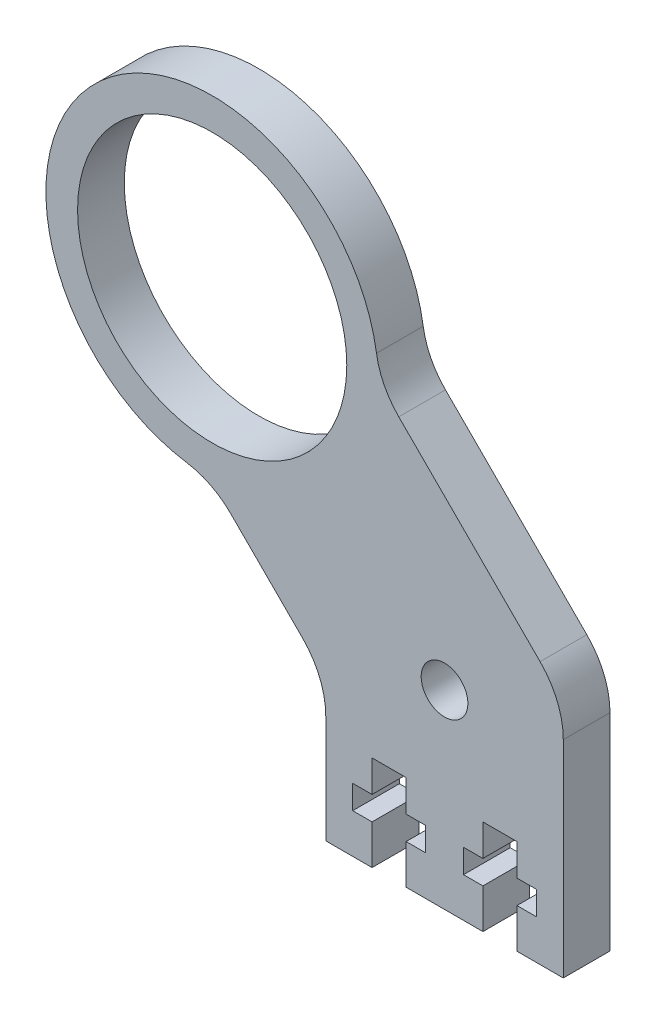
from build123d import *

# Parameters (mm, degrees)
SKETCH1_R           = 2.95
BOSS_EXTRUDE1_DEPTH = 5.9
SKETCH2_R           = 17
CUT_EXTRUDE1_DEPTH  = 72.442524026
CUT_EXTRUDE2_DEPTH  = 72.442524026
FILLET1_R           = 10


with BuildPart() as part:
    # Sketch1 → Boss-Extrude1 (new body)
    with BuildSketch(Plane.XY):
        with BuildLine():
            Line((-15, -6.213203436), (-15, -24))
            Line((-15, -24), (15, -24))
            Line((15, -24), (15, 6.213203436))
            Line((15, 6.213203436), (-8.346024856, 29.559228292))
            ThreePointArc((-8.346024856, 29.559228292), (-44.194173824, 44.194173824), (-29.559228292, 8.346024856))
            Line((-29.559228292, 8.346024856), (-15, -6.213203436))
        make_face()
        Circle(SKETCH1_R, mode=Mode.SUBTRACT)
    extrude(amount=BOSS_EXTRUDE1_DEPTH)

    # Sketch2 → Cut-Extrude1 (cut, through all)
    with BuildSketch(Plane.XY.offset(5.9)):
        with Locations((-29.344931419, 29.344931419)):
            Circle(SKETCH2_R)
    extrude(amount=-CUT_EXTRUDE1_DEPTH, mode=Mode.SUBTRACT)

    # Sketch3 → Cut-Extrude2 (cut, through all)
    with BuildSketch(Plane.XY.offset(5.9)):
        Polygon((-9.15, -24), (-4.85, -24), (-4.85, -19), (-2.4, -19), (-2.4, -16), (-4.85, -16), (-4.85, -12), (-9.15, -12), (-9.15, -16), (-11.6, -16), (-11.6, -19), (-9.15, -19), align=None)
        Polygon((4.85, -16), (4.85, -12), (9.15, -12), (9.15, -16), (11.6, -16), (11.6, -19), (9.15, -19), (9.15, -24), (4.85, -24), (4.85, -19), (2.4, -19), (2.4, -16), align=None)
    extrude(amount=-CUT_EXTRUDE2_DEPTH, mode=Mode.SUBTRACT)

    # Fillet1
    fillet1_edges = [part.edges().sort_by_distance(p)[0] for p in [
        (-15, -6.213203436, 2.95),
        (15, 6.213203436, 2.95),
        (-29.559228292, 8.346024856, 2.95),
        (-8.346024856, 29.559228292, 2.95),
    ]]
    fillet(fillet1_edges, radius=FILLET1_R)


solid = part.part
